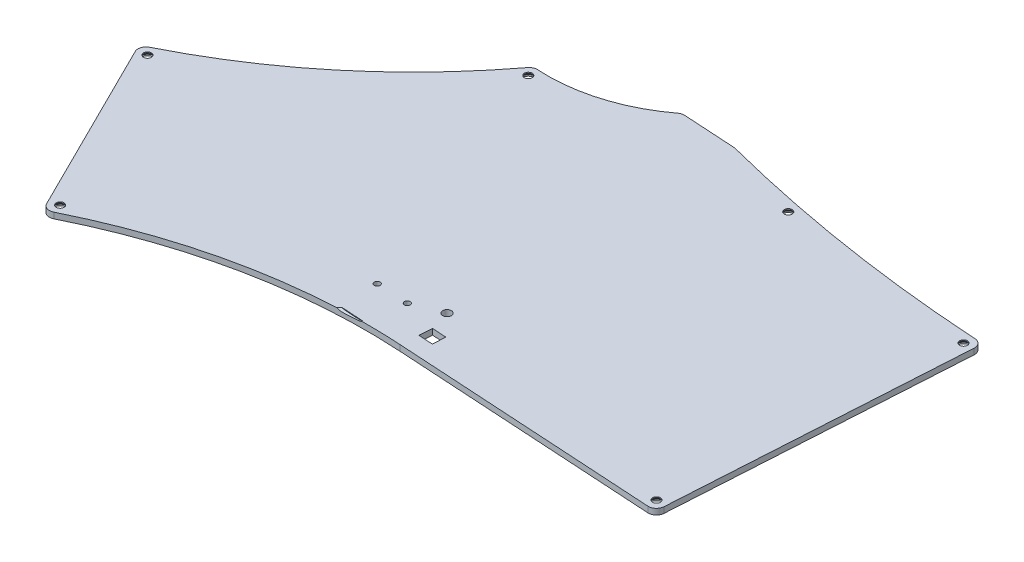
from build123d import *

# Parameters (mm, degrees)
SKETCH1_R                = 1
SKETCH1_R_2              = 1.5
SKETCH1_R_3              = 1.35
MAIN_PLATE_DEPTH         = 2
SKETCH2_R                = 2.5
SCREW_HOLES_DEPTH        = 1.7
SCREW_HOLES_CHAMFER_SIZE = 1.2


with BuildPart() as part:
    # Sketch1 → Main_plate (new body)
    with BuildSketch(Plane(origin=(0, 0, 0), x_dir=(1, 0, 0), z_dir=(0, 1, 0))):
        with BuildLine():
            Line((-85.7928409, -82.301697444), (-55.755812757, -142.75024532))
            ThreePointArc((-55.755812757, -142.75024532), (-54.140343173, -144.158373046), (-52.002337011, -144.011760212))
            ThreePointArc((-52.002337011, -144.011760212), (-3.951682628, -127.514559525), (46.728283967, -123.969985789))
            Line((46.728283967, -123.969985789), (137.274321343, -129.465618584))
            ThreePointArc((137.274321343, -129.465618584), (139.300267663, -128.766971907), (140.238810242, -126.840393723))
            Line((140.238810242, -126.840393723), (146.327388064, -26.524995005))
            ThreePointArc((146.327388064, -26.524995005), (145.628741387, -24.499048684), (143.702163203, -23.560506106))
            ThreePointArc((143.702163203, -23.560506106), (94.476527457, -18.20079206), (45.987943487, -8.163512858))
            ThreePointArc((45.987943487, -8.163512858), (45.725737799, -8.109235511), (45.459546448, -8.080252452))
            Line((45.459546448, -8.080252452), (27.492609364, -6.989760902))
            ThreePointArc((27.492609364, -6.989760902), (26.515953382, -7.103440368), (25.638814565, -7.547745919))
            ThreePointArc((25.638814565, -7.547745919), (8.167641381, -16.397587105), (-11.285751241, -18.661896472))
            ThreePointArc((-11.285751241, -18.661896472), (-12.626973233, -18.913649552), (-13.689904343, -19.76947284))
            ThreePointArc((-13.689904343, -19.76947284), (-45.694454746, -53.276077835), (-84.531326007, -78.548221698))
            ThreePointArc((-84.531326007, -78.548221698), (-85.939453733, -80.163691282), (-85.7928409, -82.301697444))
        make_face()
        with Locations(Location((24.759473712, -109.793011675, 0), (0, 0, 270))):
            Circle(SKETCH1_R, mode=Mode.SUBTRACT)
        with Locations(Location((35.739268597, -110.459423178, 0), (0, 0, 270))):
            Circle(SKETCH1_R, mode=Mode.SUBTRACT)
        with Locations(Location((45.493229955, -106.563189377, 0), (0, 0, 270))):
            Circle(SKETCH1_R_2, mode=Mode.SUBTRACT)
        with Locations(Location((143.003172699, -26.823913699, 0), (0, 0, 270))):
            Circle(SKETCH1_R_3, mode=Mode.SUBTRACT)
        with Locations(Location((73.916954773, -17.899251104, 0), (0, 0, 270))):
            Circle(SKETCH1_R_3, mode=Mode.SUBTRACT)
        with Locations(Location((-11.217743895, -21.971485999, 0), (0, 0, 270))):
            Circle(SKETCH1_R_3, mode=Mode.SUBTRACT)
        with Locations(Location((-82.615354782, -81.280438678, 0), (0, 0, 270))):
            Circle(SKETCH1_R_3, mode=Mode.SUBTRACT)
        with Locations(Location((-53.022766816, -140.834565069, 0), (0, 0, 270))):
            Circle(SKETCH1_R_3, mode=Mode.SUBTRACT)
        with Locations(Location((136.975163208, -126.141388687, 0), (0, 0, 270))):
            Circle(SKETCH1_R_3, mode=Mode.SUBTRACT)
        Polygon((47.520707964, -113.598943276), (52.411707503, -113.895799309), (52.145142902, -118.287717263), (47.254143363, -117.99086123), align=None, mode=Mode.SUBTRACT)
    extrude(amount=MAIN_PLATE_DEPTH)

    # Sketch2 → Screw_holes (cut)
    with BuildSketch(Plane.XZ):
        with Locations(Location((136.975163208, 126.141388687, 0), (0, 0, 270))):
            Circle(SKETCH2_R)
        with Locations(Location((-53.022766816, 140.834565069, 0), (0, 0, 270))):
            Circle(SKETCH2_R)
        with Locations(Location((-82.615354782, 81.280438678, 0), (0, 0, 270))):
            Circle(SKETCH2_R)
        with Locations(Location((-11.217743895, 21.971485999, 0), (0, 0, 270))):
            Circle(SKETCH2_R)
        with Locations(Location((73.916954773, 17.899251104, 0), (0, 0, 270))):
            Circle(SKETCH2_R)
        with Locations(Location((143.003172699, 26.823913699, 0), (0, 0, 270))):
            Circle(SKETCH2_R)
    extrude(amount=-SCREW_HOLES_DEPTH, mode=Mode.SUBTRACT)

    # Screw_holes_chamfer
    # the kernel refuses this chamfer: 1.2 mm, written as the material it adds along each edge
    with BuildSketch(Plane(origin=(143.003172699, 1.7, 26.823913699), x_dir=(0, 0, -1), z_dir=(-1, 0, 0))) as screw_holes_chamfer_piece_1_section:
        Polygon((2.5, SCREW_HOLES_CHAMFER_SIZE), (2.5 - SCREW_HOLES_CHAMFER_SIZE, 0), (2.5, 0), align=None)
    screw_holes_chamfer_piece_1 = revolve(axis=Axis((143.003172699, 1.7, 26.823913699), (0, -1, 0)), mode=Mode.PRIVATE)
    screw_holes_chamfer_piece_1 = screw_holes_chamfer_piece_1 - Plane(origin=(143.003172699, 1.073479929, 26.823913699), x_dir=(0, 0, 1), z_dir=(0, -1, 0)) * Cylinder(1.35, 10, mode=Mode.PRIVATE)
    add(screw_holes_chamfer_piece_1)
    with BuildSketch(Plane(origin=(73.916954773, 1.7, 17.899251104), x_dir=(0, 0, -1), z_dir=(-1, 0, 0))) as screw_holes_chamfer_piece_2_section:
        Polygon((2.5, SCREW_HOLES_CHAMFER_SIZE), (2.5 - SCREW_HOLES_CHAMFER_SIZE, 0), (2.5, 0), align=None)
    screw_holes_chamfer_piece_2 = revolve(axis=Axis((73.916954773, 1.7, 17.899251104), (0, -1, 0)), mode=Mode.PRIVATE)
    screw_holes_chamfer_piece_2 = screw_holes_chamfer_piece_2 - Plane(origin=(73.916954773, 1.073479929, 17.899251104), x_dir=(0, 0, 1), z_dir=(0, -1, 0)) * Cylinder(1.35, 10, mode=Mode.PRIVATE)
    add(screw_holes_chamfer_piece_2)
    with BuildSketch(Plane(origin=(-11.217743895, 1.7, 21.971485999), x_dir=(0, 0, -1), z_dir=(-1, 0, 0))) as screw_holes_chamfer_piece_3_section:
        Polygon((2.5, SCREW_HOLES_CHAMFER_SIZE), (2.5 - SCREW_HOLES_CHAMFER_SIZE, 0), (2.5, 0), align=None)
    screw_holes_chamfer_piece_3 = revolve(axis=Axis((-11.217743895, 1.7, 21.971485999), (0, -1, 0)), mode=Mode.PRIVATE)
    screw_holes_chamfer_piece_3 = screw_holes_chamfer_piece_3 - Plane(origin=(-11.217743895, 1.073479929, 21.971485999), x_dir=(0, 0, 1), z_dir=(0, -1, 0)) * Cylinder(1.35, 10, mode=Mode.PRIVATE)
    add(screw_holes_chamfer_piece_3)
    with BuildSketch(Plane(origin=(-82.615354782, 1.7, 81.280438678), x_dir=(0, 0, -1), z_dir=(-1, 0, 0))) as screw_holes_chamfer_piece_4_section:
        Polygon((2.5, SCREW_HOLES_CHAMFER_SIZE), (2.5 - SCREW_HOLES_CHAMFER_SIZE, 0), (2.5, 0), align=None)
    screw_holes_chamfer_piece_4 = revolve(axis=Axis((-82.615354782, 1.7, 81.280438678), (0, -1, 0)), mode=Mode.PRIVATE)
    screw_holes_chamfer_piece_4 = screw_holes_chamfer_piece_4 - Plane(origin=(-82.615354782, 1.073479929, 81.280438678), x_dir=(0, 0, 1), z_dir=(0, -1, 0)) * Cylinder(1.35, 11, mode=Mode.PRIVATE)
    add(screw_holes_chamfer_piece_4)
    with BuildSketch(Plane(origin=(-53.022766816, 1.7, 140.834565069), x_dir=(0, 0, -1), z_dir=(-1, 0, 0))) as screw_holes_chamfer_piece_5_section:
        Polygon((2.5, SCREW_HOLES_CHAMFER_SIZE), (2.5 - SCREW_HOLES_CHAMFER_SIZE, 0), (2.5, 0), align=None)
    screw_holes_chamfer_piece_5 = revolve(axis=Axis((-53.022766816, 1.7, 140.834565069), (0, -1, 0)), mode=Mode.PRIVATE)
    screw_holes_chamfer_piece_5 = screw_holes_chamfer_piece_5 - Plane(origin=(-53.022766816, 1.073479929, 140.834565069), x_dir=(0, 0, 1), z_dir=(0, -1, 0)) * Cylinder(1.35, 10, mode=Mode.PRIVATE)
    add(screw_holes_chamfer_piece_5)
    with BuildSketch(Plane(origin=(136.975163208, 1.7, 126.141388687), x_dir=(0, 0, -1), z_dir=(-1, 0, 0))) as screw_holes_chamfer_piece_6_section:
        Polygon((2.5, SCREW_HOLES_CHAMFER_SIZE), (2.5 - SCREW_HOLES_CHAMFER_SIZE, 0), (2.5, 0), align=None)
    screw_holes_chamfer_piece_6 = revolve(axis=Axis((136.975163208, 1.7, 126.141388687), (0, -1, 0)), mode=Mode.PRIVATE)
    screw_holes_chamfer_piece_6 = screw_holes_chamfer_piece_6 - Plane(origin=(136.975163208, 1.073479929, 126.141388687), x_dir=(0, 0, 1), z_dir=(0, -1, 0)) * Cylinder(1.35, 10, mode=Mode.PRIVATE)
    add(screw_holes_chamfer_piece_6)

    # Sketch4 → Cut-Loft1 section 0
    with BuildSketch(Plane(origin=(-7.640186202, 0, 125.879695971), x_dir=(0.9981631713309721, 0, 0.060582863901407005), z_dir=(-0.060582863901407005, 0, 0.9981631713309721))):
        with BuildLine():
            Line((34.465569885, 10.749979768), (39.265569885, 10.749979768))
            ThreePointArc((39.265569885, 10.749979768), (44.515569885, 5.499979768), (39.265569885, 0.249979768))
            Line((39.265569885, 0.249979768), (34.465569885, 0.249979768))
            ThreePointArc((34.465569885, 0.249979768), (29.215569885, 5.499979768), (34.465569885, 10.749979768))
        make_face()
    # Sketch3 → Cut-Loft1 section 1
    with BuildSketch(Plane(origin=(-7.337271882, 0, 120.888880114), x_dir=(0.9981631713309721, 0, 0.060582863901407005), z_dir=(-0.060582863901407005, 0, 0.9981631713309721))):
        with BuildLine():
            Line((34.465569885, 9.25), (39.265569885, 9.25))
            ThreePointArc((39.265569885, 9.25), (43.015590117, 5.499979768), (39.265569885, 1.749959536))
            Line((39.265569885, 1.749959536), (34.465569885, 1.749959536))
            ThreePointArc((34.465569885, 1.749959536), (30.715549653, 5.499979768), (34.465569885, 9.25))
        make_face()
    loft(mode=Mode.SUBTRACT)


solid = part.part
